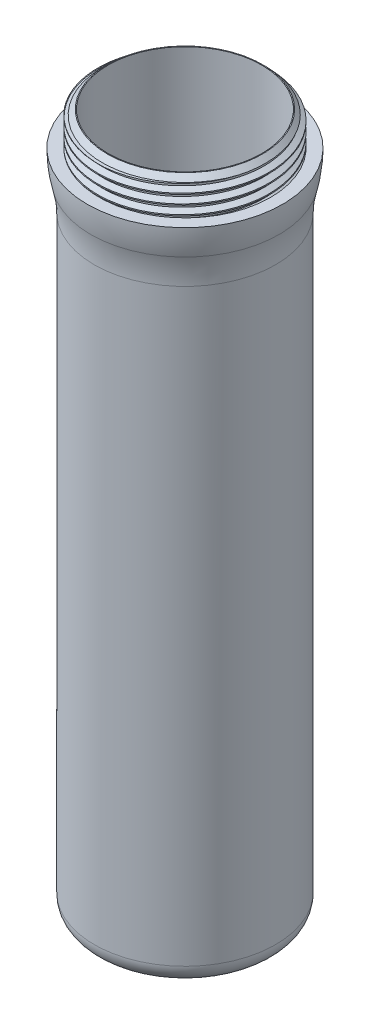
from build123d import *

# Parameters (mm, degrees)
SKETCH1_R           = 20.6375
SKETCH1_R_2         = 17.4625
BOSS_EXTRUDE1_DEPTH = 155.575
BOSS_EXTRUDE2_START = 3.175
SKETCH2_R           = 20.6375
BOSS_EXTRUDE2_DEPTH = 3.175
CUT_EXTRUDE1_START  = -7.62
SKETCH13_R          = 20.6375
SKETCH13_R_2        = 19.4945
CUT_EXTRUDE1_DEPTH  = 7.62
THREAD1_PITCH       = 2.116666667
FILLET1_R           = 1.27
FILLET2_R           = 4.445


with BuildPart() as part:
    # Sketch1 → Boss-Extrude1 (new body)
    with BuildSketch(Plane(origin=(0, 0, 0), x_dir=(1, 0, 0), z_dir=(0, 1, 0))):
        with Locations(Location((0, 0, 0), (0, 0, 270))):
            Circle(SKETCH1_R)
        with Locations(Location((0, 0, 0), (0, 0, 270))):
            Circle(SKETCH1_R_2, mode=Mode.SUBTRACT)
    extrude(amount=BOSS_EXTRUDE1_DEPTH)

    # Sketch2 → Boss-Extrude2 (add)
    with BuildSketch(Plane(origin=(0, 0, 0), x_dir=(-1, 0, 0), z_dir=(0, -1, 0)).offset(BOSS_EXTRUDE2_START)):
        with Locations(Location((0, 0, 0), (0, 0, 90))):
            Circle(SKETCH2_R)
    extrude(amount=-BOSS_EXTRUDE2_DEPTH)

    # Sketch13 → Cut-Extrude1 (cut)
    with BuildSketch(Plane(origin=(0, 155.575, 0), x_dir=(1, 0, 0), z_dir=(0, 1, 0)).offset(CUT_EXTRUDE1_START)):
        with Locations(Location((0, 0, 0), (0, 0, 90))):
            Circle(SKETCH13_R)
        with Locations(Location((0, 0, 0), (0, 0, 270))):
            Circle(SKETCH13_R_2, mode=Mode.SUBTRACT)
    extrude(amount=CUT_EXTRUDE1_DEPTH, mode=Mode.SUBTRACT)

    # Thread1: the profile of Thread Profile1 profile screwed along a right-hand helix of 4.8 turns, 10 arcs to a turn; built about Z, then put on its axis
    thread1_z = Axis((0, 0, 0), (0, 0, 1))
    thread1_corners = [(19.4948, 0, -0.000173205), (19.4948, 0, 1.852256533), (18.348820565, 0, 1.190624997), (18.348820565, 0, 0.66145833)]
    with BuildLine(mode=Mode.PRIVATE) as thread1_profile:
        Line(thread1_corners[0], thread1_corners[1])
        Line(thread1_corners[1], thread1_corners[2])
        Line(thread1_corners[2], thread1_corners[3])
        Line(thread1_corners[3], thread1_corners[0])
    thread1_cap = Face(thread1_profile.wire())
    thread1_turn_angles = [0, 18, 36, 54, 72, 90, 108, 126, 144, 162, 180, 198, 216, 234, 252, 270, 288, 306, 324, 342, 360]
    thread1_turn_weights = [1, 0.9510565162951535, 1, 0.9510565162951535, 1, 0.9510565162951535, 1, 0.9510565162951535, 1, 0.9510565162951535, 1, 0.9510565162951535, 1, 0.9510565162951535, 1, 0.9510565162951535, 1, 0.9510565162951535, 1, 0.9510565162951535, 1]
    thread1_turn_rails = [Edge.make_bspline([Vector(p[0], p[1], 0).rotate(thread1_z, thread1_turn_angles[k]) / thread1_turn_weights[k] + Vector(0, 0, p[2] + THREAD1_PITCH * thread1_turn_angles[k] / 360) for k in range(21)], [0, 0, 0, 1, 1, 2, 2, 3, 3, 4, 4, 5, 5, 6, 6, 7, 7, 8, 8, 9, 9, 10, 10, 10], 2, thread1_turn_weights) for p in thread1_corners]
    thread1_turn_sides = [Face.make_surface_from_curves(thread1_turn_rails[p[0]], thread1_turn_rails[p[1]]) for p in [(0, 1), (1, 2), (2, 3), (3, 0)]]
    thread1_last_angles = [1440, 1458, 1476, 1494, 1512, 1530, 1548, 1566, 1584, 1602, 1620, 1638, 1656, 1674, 1692, 1710, 1728]
    thread1_last_weights = [1, 0.9510565162951535, 1, 0.9510565162951535, 1, 0.9510565162951535, 1, 0.9510565162951535, 1, 0.9510565162951535, 1, 0.9510565162951535, 1, 0.9510565162951535, 1, 0.951056516295164, 1]
    thread1_last_rails = [Edge.make_bspline([Vector(p[0], p[1], 0).rotate(thread1_z, thread1_last_angles[k]) / thread1_last_weights[k] + Vector(0, 0, p[2] + THREAD1_PITCH * thread1_last_angles[k] / 360) for k in range(17)], [0, 0, 0, 1, 1, 2, 2, 3, 3, 4, 4, 5, 5, 6, 6, 7, 7, 8, 8, 8], 2, thread1_last_weights) for p in thread1_corners]
    thread1_last_sides = [Face.make_surface_from_curves(thread1_last_rails[p[0]], thread1_last_rails[p[1]]) for p in [(0, 1), (1, 2), (2, 3), (3, 0)]]
    thread1 = Plane(origin=(0, 158.115, 0), x_dir=(-1, 0, 0), z_dir=(0, -1, 0)) * Solid(Shell([*[p.moved(Location((0, 0, THREAD1_PITCH * i))) for i in range(4) for p in thread1_turn_sides], *thread1_last_sides, thread1_cap, thread1_cap.rotate(thread1_z, 1728).moved(Location((0, 0, THREAD1_PITCH * 1728 / 360)))]))
    add(thread1, mode=Mode.SUBTRACT)

    # Sketch16 → Cut-Revolve1 (revolve, cut)
    with BuildSketch(Plane.XY, mode=Mode.PRIVATE) as cut_revolve1_sk:
        Polygon((-16.51, 156.718), (-18.796, 154.432), (-21.615025571, 154.432), (-21.615025571, 156.718), align=None)
    revolve(cut_revolve1_sk.sketch.rotate(Axis((0, 0, 0), (0, 1, 0)), 270), axis=Axis((0, 0, 0), (0, 1, 0)), mode=Mode.SUBTRACT)

    # Sketch18 → Revolve1 (revolve)
    with BuildSketch(Plane.XY, mode=Mode.PRIVATE) as revolve1_sk:
        with BuildLine():
            Line((-20.6375, 147.955), (-22.225, 147.955))
            ThreePointArc((-22.225, 147.955), (-22.025793351, 144.755291456), (-21.43125, 141.605))
            ThreePointArc((-21.43125, 141.605), (-20.836706649, 138.454708544), (-20.6375, 135.255))
            Line((-20.6375, 135.255), (-20.6375, 147.955))
        make_face()
    revolve(revolve1_sk.sketch.rotate(Axis((0, 147.955, 0), (0, -1, 0)), 77.954723844), axis=Axis((0, 147.955, 0), (0, -1, 0)))

    # Fillet1
    fillet1_edges = [part.edges().sort_by_distance(p)[0] for p in [
        (0, 0, -17.4625),
    ]]
    fillet(fillet1_edges, radius=FILLET1_R)

    # Fillet2
    fillet2_edges = [part.edges().sort_by_distance(p)[0] for p in [
        (0, -3.175, 20.6375),
    ]]
    fillet(fillet2_edges, radius=FILLET2_R)


solid = part.part
